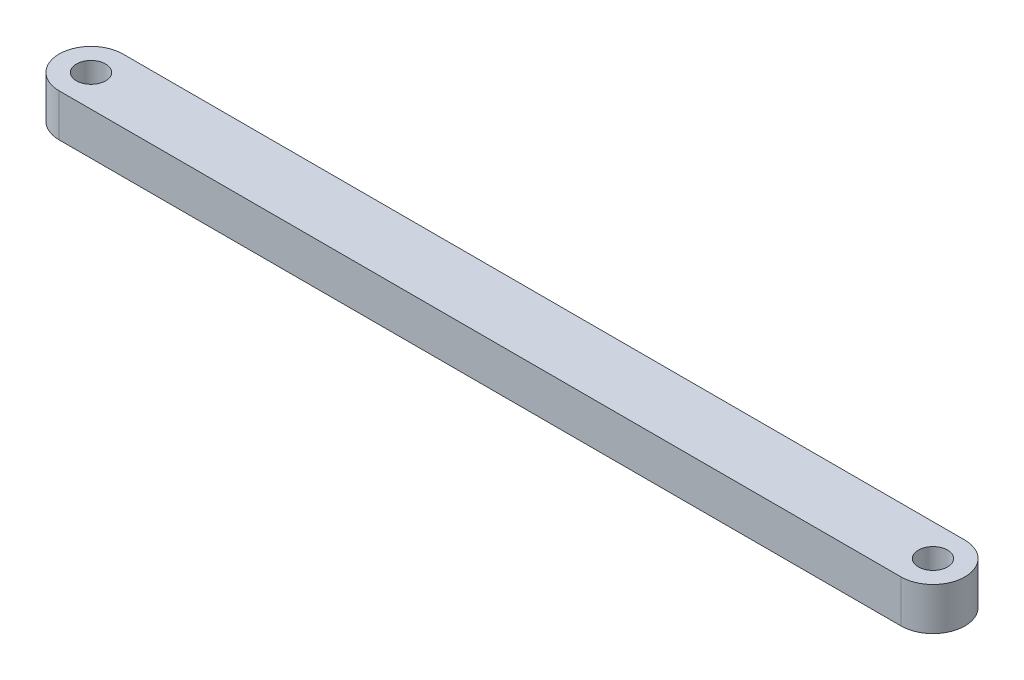
from build123d import *

# Parameters (mm, degrees)
SKETCH1_R           = 2.1828125
BOSS_EXTRUDE1_DEPTH = 6.35


with BuildPart() as part:
    # Sketch1 → Boss-Extrude1 (new body)
    with BuildSketch(Plane(origin=(0, 0, 0), x_dir=(1, 0, 0), z_dir=(0, 1, 0))):
        with BuildLine():
            Line((0, 4.7625), (125.72238, 4.7625))
            ThreePointArc((125.72238, 4.7625), (130.48488, 0), (125.72238, -4.7625))
            Line((125.72238, -4.7625), (0, -4.7625))
            ThreePointArc((0, -4.7625), (-4.7625, 0), (0, 4.7625))
        make_face()
        Circle(SKETCH1_R, mode=Mode.SUBTRACT)
        with Locations((125.72238, 0)):
            Circle(SKETCH1_R, mode=Mode.SUBTRACT)
    extrude(amount=BOSS_EXTRUDE1_DEPTH)


solid = part.part
